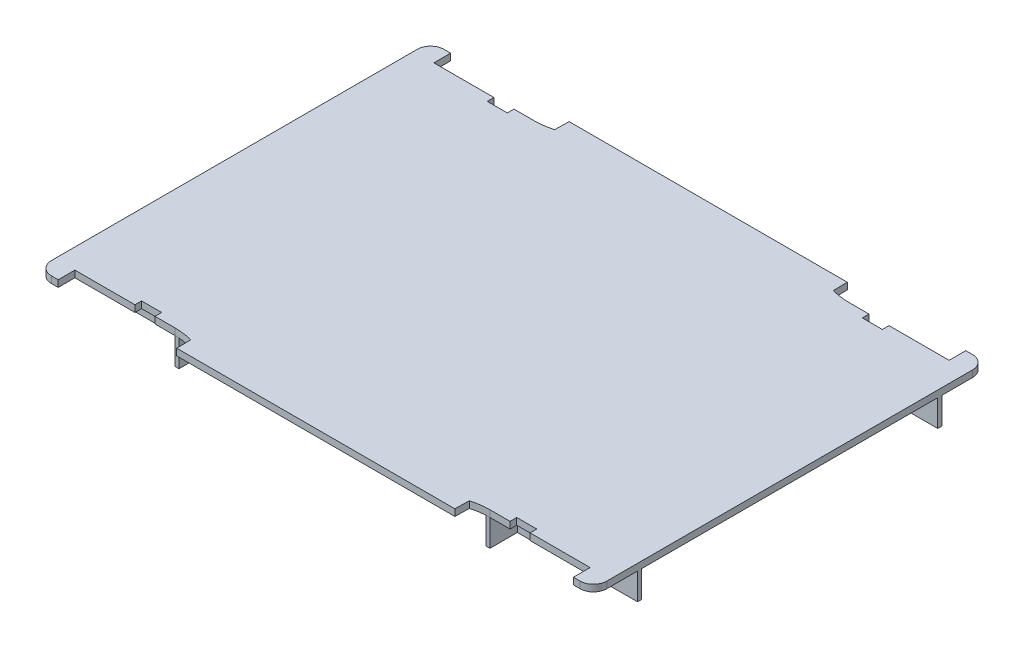
from build123d import *

# Parameters (mm, degrees)
CROQUIS1_W               = 416
CROQUIS1_H               = 294
SALIENTE_EXTRUIR1_DEPTH  = 5
CORTAR_EXTRUIR1_DEPTH    = 255.750858684
REDONDEO1_R              = 10
SALIENTE_EXTRUIR3_DEPTH  = 20
REDONDEO2_R              = 5
REDONDEO2_OF_SIMETR_A3_R = 5
SIMETR_A4_DEPTH          = 5
SIMETR_A4_START          = -20
SIMETR_A4_2_DEPTH        = 20
ESCALA1_SCALE            = 2


# Read off the part's stored shape, not the designer's step: Simetría4
with BuildPart() as part:
    # Croquis1 → Saliente-Extruir1 (new body)
    with BuildSketch(Plane(origin=(0, 0, 0), x_dir=(1, 0, 0), z_dir=(0, 1, 0))):
        Rectangle(CROQUIS1_W, CROQUIS1_H)
    extrude(amount=SALIENTE_EXTRUIR1_DEPTH)

    # Croquis3 → Cortar-Extruir1 (cut, through all)
    with BuildSketch(Plane(origin=(0, 5, 0), x_dir=(1, 0, 0), z_dir=(0, 1, 0))):
        with BuildLine():
            Line((-193, 154.47), (-193, 134.47))
            Line((-193, 134.47), (-148, 134.47))
            Line((-148, 134.47), (-148, 129.47))
            Line((-148, 129.47), (-133, 129.47))
            Line((-133, 129.47), (-133, 134.47))
            Line((-133, 134.47), (-118, 134.47))
            ThreePointArc((-118, 134.47), (-111.127739024, 134.944531511), (-104.385922224, 136.359118837))
            Line((-104.385922224, 136.359118837), (-104, 156.355395091))
            Line((-104, 156.355395091), (-193, 156.355395091))
            Line((-193, 156.355395091), (-193, 154.47))
        make_face()
    cortar_extruir1 = extrude(amount=-CORTAR_EXTRUIR1_DEPTH, mode=Mode.SUBTRACT)

    # Simetría1: Cortar-Extruir1 across plane
    add(cortar_extruir1.mirror(Plane.XY), mode=Mode.SUBTRACT)

    # Redondeo1
    redondeo1_edges = [part.edges().sort_by_distance(p)[0] for p in [
        (-208, 2.5, -147),
        (208, 2.5, -147),
        (208, 2.5, 147),
        (-208, 2.5, 147),
    ]]
    fillet(redondeo1_edges, radius=REDONDEO1_R)

    # Croquis5 → Saliente-Extruir3 (add)
    with BuildSketch(Plane.XZ):
        Polygon((-208, 110.96), (-115, 110.96), (-115, 134.560081146), (-118, 134.47), (-118, 113.96), (-208, 113.96), align=None)
    saliente_extruir3 = extrude(amount=SALIENTE_EXTRUIR3_DEPTH)

    # Redondeo2
    redondeo2_edges = [part.edges().sort_by_distance(p)[0] for p in [
        (-115, -10, 110.96),
    ]]
    fillet(redondeo2_edges, radius=REDONDEO2_R)

    # Simetría3: Saliente-Extruir3 across plane
    add(saliente_extruir3.mirror(Plane.XY))

    # Redondeo2 of Simetría3
    redondeo2_of_simetr_a3_edges = [part.edges().sort_by_distance(p)[0] for p in [
        (-115, -10, -110.96),
    ]]
    fillet(redondeo2_of_simetr_a3_edges, radius=REDONDEO2_OF_SIMETR_A3_R)

    # Simetría4 outline → Simetría4 (cut)
    with BuildSketch(Plane(origin=(0, 0, 0), x_dir=(1, 0, 0), z_dir=(0, 1, 0))):
        with BuildLine():
            Line((148, 134.47), (193, 134.47))
            Line((193, 134.47), (193, 147))
            Line((193, 147), (104.180556361, 147))
            Line((104.180556361, 147), (104.385922224, 136.359118837))
            ThreePointArc((104.385922224, 136.359118837), (111.127739024, 134.944531511), (118, 134.47))
            Line((118, 134.47), (133, 134.47))
            Line((133, 134.47), (133, 129.47))
            Line((133, 129.47), (148, 129.47))
            Line((148, 129.47), (148, 134.47))
        make_face()
        with BuildLine():
            Line((133, -134.47), (118, -134.47))
            ThreePointArc((118, -134.47), (111.127739024, -134.944531511), (104.385922224, -136.359118837))
            Line((104.385922224, -136.359118837), (104.180556361, -147))
            Line((104.180556361, -147), (193, -147))
            Line((193, -147), (193, -134.47))
            Line((193, -134.47), (148, -134.47))
            Line((148, -134.47), (148, -129.47))
            Line((148, -129.47), (133, -129.47))
            Line((133, -129.47), (133, -134.47))
        make_face()
    extrude(amount=SIMETR_A4_DEPTH, mode=Mode.SUBTRACT)

    # Simetr_a4 2 outline → Simetr_a4 2 (add)
    with BuildSketch(Plane(origin=(0, 0, 0), x_dir=(1, 0, 0), z_dir=(0, 1, 0)).offset(SIMETR_A4_START)):
        with BuildLine():
            Line((208, -113.96), (208, -110.96))
            Line((208, -110.96), (120, -110.96))
            ThreePointArc((120, -110.96), (116.464466094, -112.424466094), (115, -115.96))
            Line((115, -115.96), (115, -134.560081146))
            Line((115, -134.560081146), (118, -134.47))
            Line((118, -134.47), (118, -113.96))
            Line((118, -113.96), (208, -113.96))
        make_face()
        with BuildLine():
            ThreePointArc((118, 134.47), (116.499323935, 134.492525361), (115, 134.560081146))
            Line((115, 134.560081146), (115, 115.96))
            ThreePointArc((115, 115.96), (116.464466094, 112.424466094), (120, 110.96))
            Line((120, 110.96), (208, 110.96))
            Line((208, 110.96), (208, 113.96))
            Line((208, 113.96), (118, 113.96))
            Line((118, 113.96), (118, 134.47))
        make_face()
    extrude(amount=SIMETR_A4_2_DEPTH)


with BuildPart() as part_1:
    # Escala1: scaled about (-0.000170943, 1.954243012, 0.000197364)
    add(part.part.scale(ESCALA1_SCALE).moved(Location((0.000170943, -1.954243012, -0.000197364))))


solid = part_1.part
